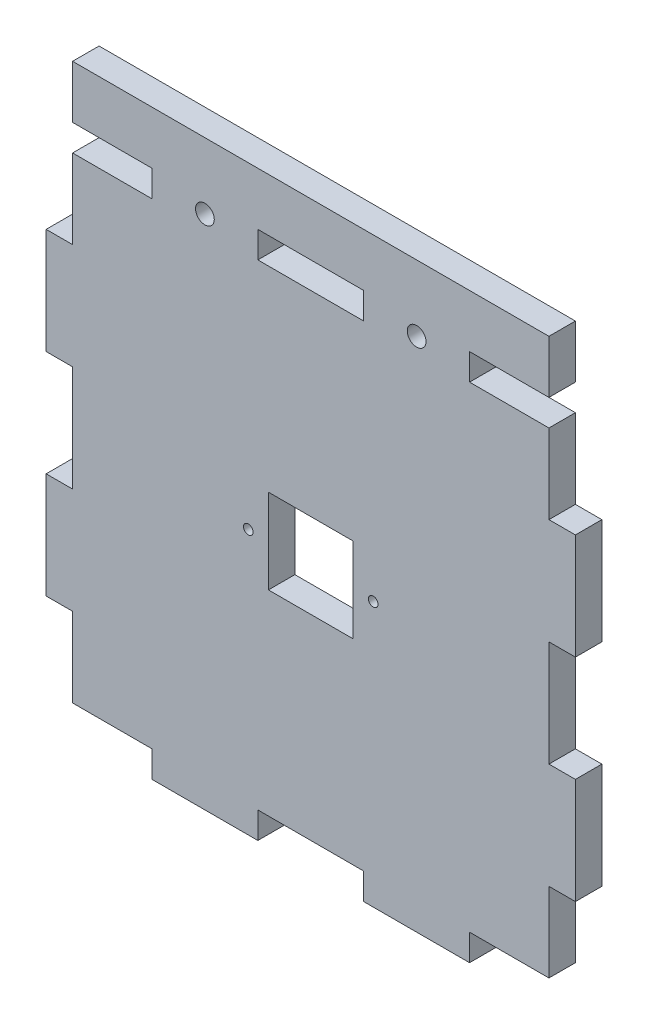
from build123d import *

# Parameters (mm, degrees)
SKETCH1_W                 = 127
SKETCH1_H                 = 139.7
BOSS_EXTRUDE1_DEPTH       = 6.35
SKETCH5_W                 = 6.35
SKETCH5_H                 = 25.4
CUT_EXTRUDE4_DEPTH        = 6.35
SKETCH6_W                 = 25.4
SKETCH6_H                 = 6.35
CUT_EXTRUDE5_DEPTH        = 6.35
LPATTERN5_COUNT           = 3
LPATTERN5_PITCH           = 50.8
LPATTERN5_COUNT_DIR2      = 2
LPATTERN5_PITCH_DIR2      = 120.65
LPATTERN6_COUNT           = 3
LPATTERN6_PITCH           = 50.8
LPATTERN6_COUNT_DIR2      = 2
LPATTERN6_PITCH_DIR2      = 120.65
SKETCH7_W                 = 6.35
SKETCH7_H                 = 19.05
CUT_EXTRUDE6_DEPTH        = 6.35
SKETCH12_W                = 6.35
SKETCH12_H                = 12.7
CUT_EXTRUDE9_DEPTH        = 7.62
F_8_CLEARANCE_HOLE1_D     = 4.4958
F_8_CLEARANCE_HOLE1_DEPTH = 10.16
F_8_CLEARANCE_HOLE1_TIP   = 1.350674586
SKETCH11_R                = 1.143
SKETCH11_W                = 20.32
SKETCH11_H                = 20.32
CUT_EXTRUDE8_DEPTH        = 7.62


with BuildPart() as part:
    # Sketch1 → Boss-Extrude1 (new body)
    with BuildSketch(Plane.XY):
        with Locations((63.5, 69.85)):
            Rectangle(SKETCH1_W, SKETCH1_H)
    extrude(amount=BOSS_EXTRUDE1_DEPTH)

    # Sketch5 → Cut-Extrude4 (cut)
    with BuildSketch(Plane.XY.offset(6.35)):
        with Locations((3.175, 12.7)):
            Rectangle(SKETCH5_W, SKETCH5_H)
    cut_extrude4 = extrude(amount=-CUT_EXTRUDE4_DEPTH, mode=Mode.SUBTRACT)

    # Sketch6 → Cut-Extrude5 (cut)
    with BuildSketch(Plane.XY.offset(6.35)):
        with Locations((12.7, 3.175)):
            Rectangle(SKETCH6_W, SKETCH6_H)
    cut_extrude5 = extrude(amount=-CUT_EXTRUDE5_DEPTH, mode=Mode.SUBTRACT)

    # LPattern5: Cut-Extrude4 3 × 2
    with Locations(*[(j * LPATTERN5_PITCH_DIR2, i * LPATTERN5_PITCH, 0) for i in range(LPATTERN5_COUNT) for j in range(LPATTERN5_COUNT_DIR2) if (i, j) != (0, 0)]):
        add(cut_extrude4, mode=Mode.SUBTRACT)

    # LPattern6: Cut-Extrude5 3 × 2
    with Locations(*[(i * LPATTERN6_PITCH, j * LPATTERN6_PITCH_DIR2, 0) for i in range(LPATTERN6_COUNT) for j in range(LPATTERN6_COUNT_DIR2) if (i, j) != (0, 0)]):
        add(cut_extrude5, mode=Mode.SUBTRACT)

    # Sketch7 → Cut-Extrude6 (cut)
    with BuildSketch(Plane.XY.offset(6.35)):
        with Locations((3.175, 130.175)):
            Rectangle(SKETCH7_W, SKETCH7_H)
    extrude(amount=-CUT_EXTRUDE6_DEPTH, mode=Mode.SUBTRACT)

    # Sketch12 → Cut-Extrude9 (cut)
    with BuildSketch(Plane.XY.offset(6.35)):
        with Locations((123.825, 133.35)):
            Rectangle(SKETCH12_W, SKETCH12_H)
    extrude(amount=-CUT_EXTRUDE9_DEPTH, mode=Mode.SUBTRACT)

    # #8 Clearance Hole1
    with Locations(Plane.XY.offset(6.35)):
        with Locations((38.1, 123.825), (88.9, 123.825)):
            Hole(F_8_CLEARANCE_HOLE1_D / 2, depth=F_8_CLEARANCE_HOLE1_DEPTH)
            with Locations((0, 0, -(F_8_CLEARANCE_HOLE1_DEPTH + F_8_CLEARANCE_HOLE1_TIP / 2))):  # 118° drill point
                Cone(0, F_8_CLEARANCE_HOLE1_D / 2, F_8_CLEARANCE_HOLE1_TIP, mode=Mode.SUBTRACT)

    # Sketch11 → Cut-Extrude8 (cut)
    with BuildSketch(Plane.XY.offset(6.35)):
        with Locations((48.514, 63.5)):
            Circle(SKETCH11_R)
        with Locations((78.486, 63.5)):
            Circle(SKETCH11_R)
        with Locations((63.5, 63.5)):
            Rectangle(SKETCH11_W, SKETCH11_H)
    extrude(amount=-CUT_EXTRUDE8_DEPTH, mode=Mode.SUBTRACT)


solid = part.part
